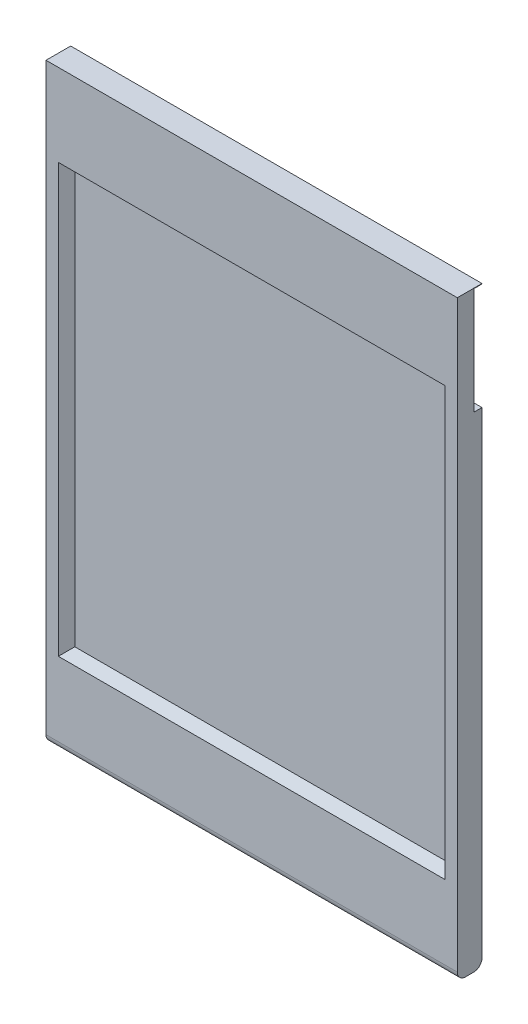
from build123d import *

# Parameters (mm, degrees)
CROQUIS1_W              = 500
CROQUIS1_H              = 720
SALIENTE_EXTRUIR1_DEPTH = 30
CROQUIS2_W              = 450
CROQUIS2_H              = 500
CORTAR_EXTRUIR1_DEPTH   = 10
CHAFL_N1_SIZE           = 10
CHAFL_N2_SIZE           = 10
REDONDEO2_R             = 10
REDONDEO3_R             = 10
CROQUIS11_W             = 480
CROQUIS11_H             = 20
CORTAR_EXTRUIR5_DEPTH   = 7
CROQUIS12_W             = 10
CROQUIS12_H             = 130
CORTAR_EXTRUIR6_DEPTH   = 20


with BuildPart() as part:
    # Croquis1 → Saliente-Extruir1 (new body)
    with BuildSketch(Plane.XY):
        Rectangle(CROQUIS1_W, CROQUIS1_H)
    extrude(amount=SALIENTE_EXTRUIR1_DEPTH)

    # Croquis2 → Cortar-Extruir1 (cut)
    with BuildSketch(Plane.XY.offset(30)):
        Rectangle(CROQUIS2_W, CROQUIS2_H)
    extrude(amount=-CORTAR_EXTRUIR1_DEPTH, mode=Mode.SUBTRACT)

    # Chaflán1
    chafl_n1_edges = [part.edges().sort_by_distance(p)[0] for p in [
        (0, 250, 30),
    ]]
    chamfer(chafl_n1_edges, length=CHAFL_N1_SIZE - 0.0001)  # a hair under: the kernel refuses the full size

    # Chaflán2
    chafl_n2_edges = [part.edges().sort_by_distance(p)[0] for p in [
        (225, 4.99995, 30),
        (0, -250, 30),
        (-225, 4.99995, 30),
    ]]
    chamfer(chafl_n2_edges, length=CHAFL_N2_SIZE - 0.0001)  # a hair under: the kernel refuses the full size

    # Redondeo2
    redondeo2_edges = [part.edges().sort_by_distance(p)[0] for p in [
        (0, -360, 30),
    ]]
    fillet(redondeo2_edges, radius=REDONDEO2_R)

    # Redondeo3
    redondeo3_edges = [part.edges().sort_by_distance(p)[0] for p in [
        (0, -360, 0),
    ]]
    fillet(redondeo3_edges, radius=REDONDEO3_R)

    # Croquis11 → Cortar-Extruir5 (cut)
    with BuildSketch(Plane(origin=(0, 0, 0), x_dir=(-1, 0, 0), z_dir=(0, 0, -1))):
        with Locations((-10, 300)):
            Rectangle(CROQUIS11_W, CROQUIS11_H)
    extrude(amount=-CORTAR_EXTRUIR5_DEPTH, mode=Mode.SUBTRACT)

    # Croquis12 → Cortar-Extruir6 (cut)
    with BuildSketch(Plane(origin=(250, 0, 0), x_dir=(0, 0, -1), z_dir=(1, 0, 0))):
        with Locations((-5, 294.429232032)):
            Rectangle(CROQUIS12_W, CROQUIS12_H)
    extrude(amount=-CORTAR_EXTRUIR6_DEPTH, mode=Mode.SUBTRACT)


solid = part.part
